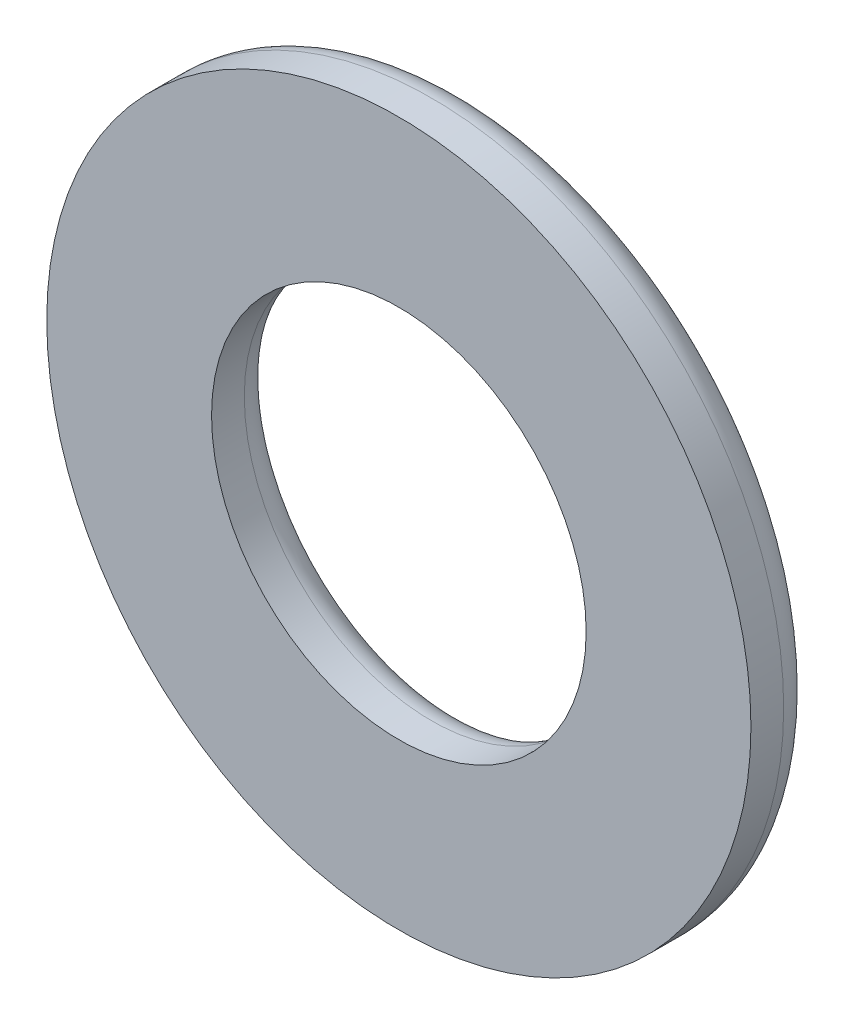
from build123d import *

# Parameters (mm, degrees)
BOSS_EXTRUDE1_DEPTH      = 0.59055
BOSS_EXTRUDE1_DEPTH_BACK = 0.59055
SKETCH3_R                = 6.35
SKETCH3_R_2              = 3.3782
FILLET1_R                = 0.59055


with BuildPart() as part:
    # Sketch3 → Boss-Extrude1 (new, two sides: drawn at the far end of the back side and taken through both)
    with BuildSketch(Plane.XY.offset(-BOSS_EXTRUDE1_DEPTH_BACK)):
        Circle(SKETCH3_R)
        Circle(SKETCH3_R_2, mode=Mode.SUBTRACT)
    extrude(amount=BOSS_EXTRUDE1_DEPTH + BOSS_EXTRUDE1_DEPTH_BACK)

    # Fillet1
    fillet1_edges = [part.edges().sort_by_distance(p)[0] for p in [
        (-6.35, 0, -0.59055),
        (-3.3782, 0, -0.59055),
    ]]
    fillet(fillet1_edges, radius=FILLET1_R - 0.0001)  # a hair under: the kernel refuses the full size


solid = part.part
